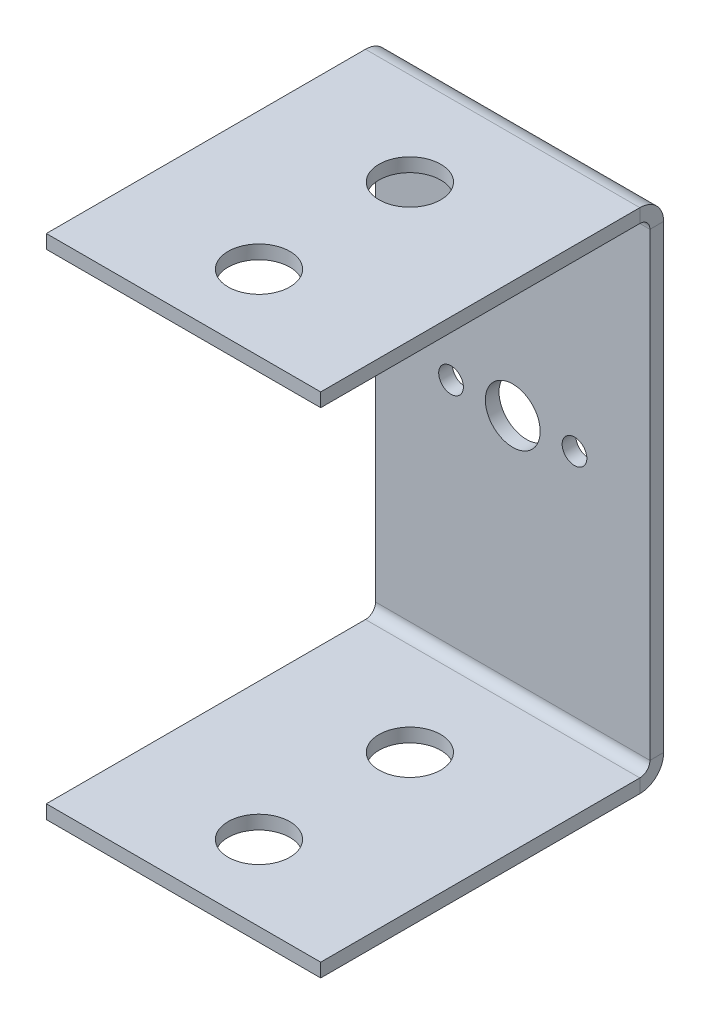
from build123d import *

# Parameters (mm, degrees)
SKETCH1_W                    = 20
SKETCH1_H                    = 37
BASE_FLANGE1_DEPTH           = 1
EDGE_FLANGE1_STRIP_W         = 5.4732
EDGE_FLANGE1_STRIP_H         = 1
EDGE_FLANGE1_STRIP_CUT_DEPTH = 20
EDGE_FLANGE1_DEPTH           = 20
SKETCH9_R                    = 2
SKETCH9_R_2                  = 0.9
CUT_EXTRUDE1_DEPTH           = 10
SKETCH10_R                   = 2.25
CUT_EXTRUDE2_DEPTH           = 46.221676218


# Sheet-metal steps are written as plain solids
with BuildPart() as part:
    # Sketch1 → Base-Flange1 (new body)
    with BuildSketch(Plane.XY):
        Rectangle(SKETCH1_W, SKETCH1_H)
    extrude(amount=-BASE_FLANGE1_DEPTH)

    # Edge-Flange1 strip (across the edge) → Edge-Flange1 strip cut (cut)
    with BuildSketch(Plane(origin=(10, 18.5, 0), x_dir=(0, -1, 0), z_dir=(-1, 0, 0))):
        with Locations((-1, -0.5)):
            Rectangle(EDGE_FLANGE1_STRIP_W, EDGE_FLANGE1_STRIP_H)
    edge_flange1_strip_cut = extrude(amount=EDGE_FLANGE1_STRIP_CUT_DEPTH, mode=Mode.SUBTRACT)

    # Edge-Flange1 section (across the edge) → Edge-Flange1 (add)
    with BuildSketch(Plane(origin=(10, 18.5, 0), x_dir=(0, -1, 0), z_dir=(-1, 0, 0))):
        with BuildLine():
            Line((0, 0.7366), (0, 24))
            Line((0, 24), (1, 24))
            Line((1, 24), (1, 0.7366))
            ThreePointArc((1, 0.7366), (1.215745145, 0.215745145), (1.7366, 0))
            Line((1.7366, 0), (1.7366, -1))
            ThreePointArc((1.7366, -1), (0.508638364, -0.491361636), (0, 0.7366))
        make_face()
    edge_flange1 = extrude(amount=EDGE_FLANGE1_DEPTH)

    # Mirror1: Edge-Flange1 strip cut, Edge-Flange1 across plane
    add(edge_flange1_strip_cut.mirror(Plane.ZX), mode=Mode.SUBTRACT)
    add(edge_flange1.mirror(Plane.ZX))

    # Sketch9 → Cut-Extrude1 (cut)
    with BuildSketch(Plane(origin=(0, 0, -1), x_dir=(-1, 0, 0), z_dir=(0, 0, -1))):
        Circle(SKETCH9_R)
        with Locations((-4.5, 0)):
            Circle(SKETCH9_R_2)
        with Locations((4.5, 0)):
            Circle(SKETCH9_R_2)
    extrude(amount=-CUT_EXTRUDE1_DEPTH, mode=Mode.SUBTRACT)

    # Sketch10 → Cut-Extrude2 (cut, through all)
    with BuildSketch(Plane(origin=(0, 18.5, 0), x_dir=(1, 0, 0), z_dir=(0, 1, 0))):
        with Locations(Location((0, -7.5, 0), (0, 0, 270))):
            Circle(SKETCH10_R)
        with Locations(Location((0, -18.5, 0), (0, 0, 270))):
            Circle(SKETCH10_R)
    extrude(amount=-CUT_EXTRUDE2_DEPTH, mode=Mode.SUBTRACT)


solid = part.part
